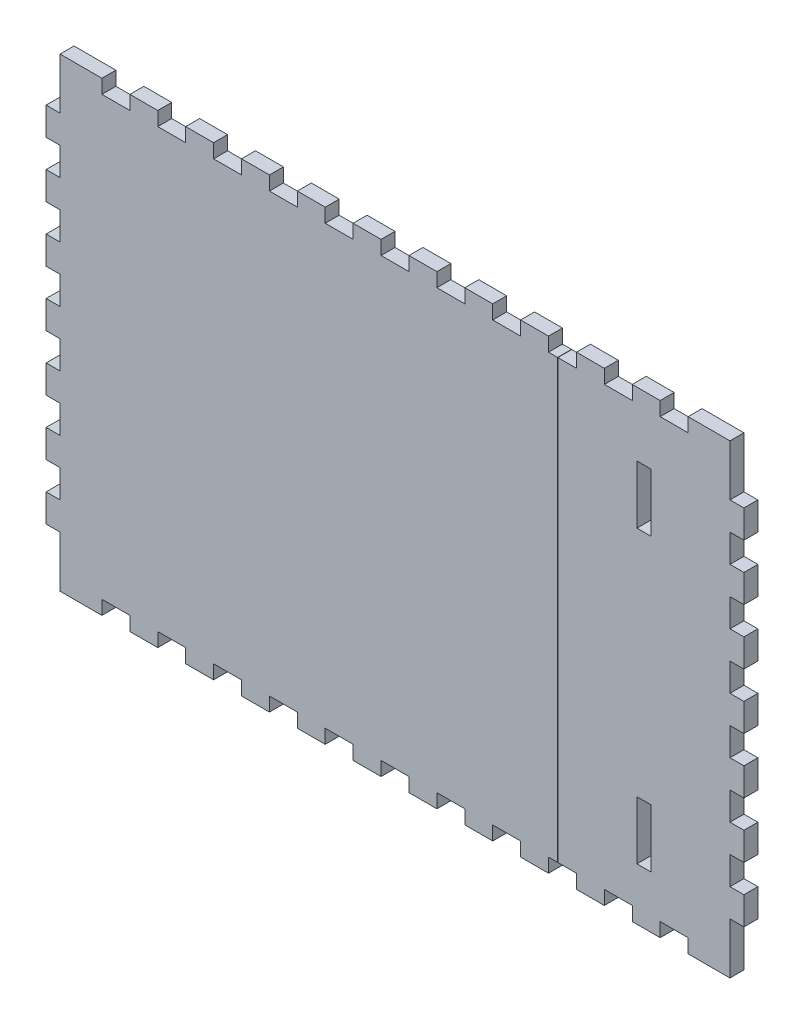
from build123d import *

# Parameters (mm, degrees)
BOSS_EXTRUDE1_DEPTH = 6
SKETCH2_W           = 6
SKETCH2_H           = 25
SKETCH2_W_2         = 0.1
SKETCH2_H_2         = 235.31007752
CUT_EXTRUDE1_DEPTH  = 6


with BuildPart() as part:
    # Model → Boss-Extrude1 (new body)
    with BuildSketch(Plane.XY):
        Polygon((209, 203), (209, 181), (203, 181), (203, 169), (209, 169), (209, 157), (203, 157), (203, 145), (209, 145), (209, 133), (203, 133), (203, 121), (209, 121), (209, 109), (203, 109), (203, 97), (209, 97), (209, 85), (203, 85), (203, 73), (209, 73), (209, 61), (203, 61), (203, 49), (209, 49), (209, 37), (203, 37), (203, 25), (209, 25), (209, 13), (209, 3), (227, 3), (227, 9), (239, 9), (239, 3), (251, 3), (251, 9), (263, 9), (263, 3), (275, 3), (275, 9), (287, 9), (287, 3), (299, 3), (299, 9), (311, 9), (311, 3), (323, 3), (323, 9), (335, 9), (335, 3), (347, 3), (347, 9), (359, 9), (359, 3), (371, 3), (371, 9), (383, 9), (383, 3), (395, 3), (395, 9), (407, 9), (407, 3), (419, 3), (419, 9), (431, 9), (431, 3), (443, 3), (443, 9), (455, 9), (455, 3), (467, 3), (467, 9), (479, 9), (479, 3), (491, 3), (497, 3), (497, 25), (503, 25), (503, 37), (497, 37), (497, 49), (503, 49), (503, 61), (497, 61), (497, 73), (503, 73), (503, 85), (497, 85), (497, 97), (503, 97), (503, 109), (497, 109), (497, 121), (503, 121), (503, 133), (497, 133), (497, 145), (503, 145), (503, 157), (497, 157), (497, 169), (503, 169), (503, 181), (497, 181), (497, 193), (497, 203), (479, 203), (479, 197), (467, 197), (467, 203), (455, 203), (455, 197), (443, 197), (443, 203), (431, 203), (431, 197), (419, 197), (419, 203), (407, 203), (407, 197), (395, 197), (395, 203), (383, 203), (383, 197), (371, 197), (371, 203), (359, 203), (359, 197), (347, 197), (347, 203), (335, 203), (335, 197), (323, 197), (323, 203), (311, 203), (311, 197), (299, 197), (299, 203), (287, 203), (287, 197), (275, 197), (275, 203), (263, 203), (263, 197), (251, 197), (251, 203), (239, 203), (239, 197), (227, 197), (227, 203), (215, 203), align=None)
    extrude(amount=BOSS_EXTRUDE1_DEPTH)

    # Sketch2 → Cut-Extrude1 (cut)
    with BuildSketch(Plane.XY.offset(6)):
        with Locations((460, 163)):
            Rectangle(SKETCH2_W, SKETCH2_H)
        with Locations((422.95, 100.5)):
            Rectangle(SKETCH2_W_2, SKETCH2_H_2)
        with Locations((460, 38)):
            Rectangle(SKETCH2_W, SKETCH2_H)
    extrude(amount=-CUT_EXTRUDE1_DEPTH, mode=Mode.SUBTRACT)


with BuildPart() as cut_extrude1_piece_1:
    # of the separate pieces the step leaves, piece 1, a body of its own (cut_extrude1_pieces)
    add(part.part.solids().sort_by_distance((209, 203, 0))[0])


with BuildPart() as cut_extrude1_piece_2:
    # of the separate pieces the step leaves, piece 2, a body of its own (cut_extrude1_pieces)
    add(part.part.solids().sort_by_distance((431, 197, 0))[0])


solid = Compound([cut_extrude1_piece_1.part, cut_extrude1_piece_2.part])
